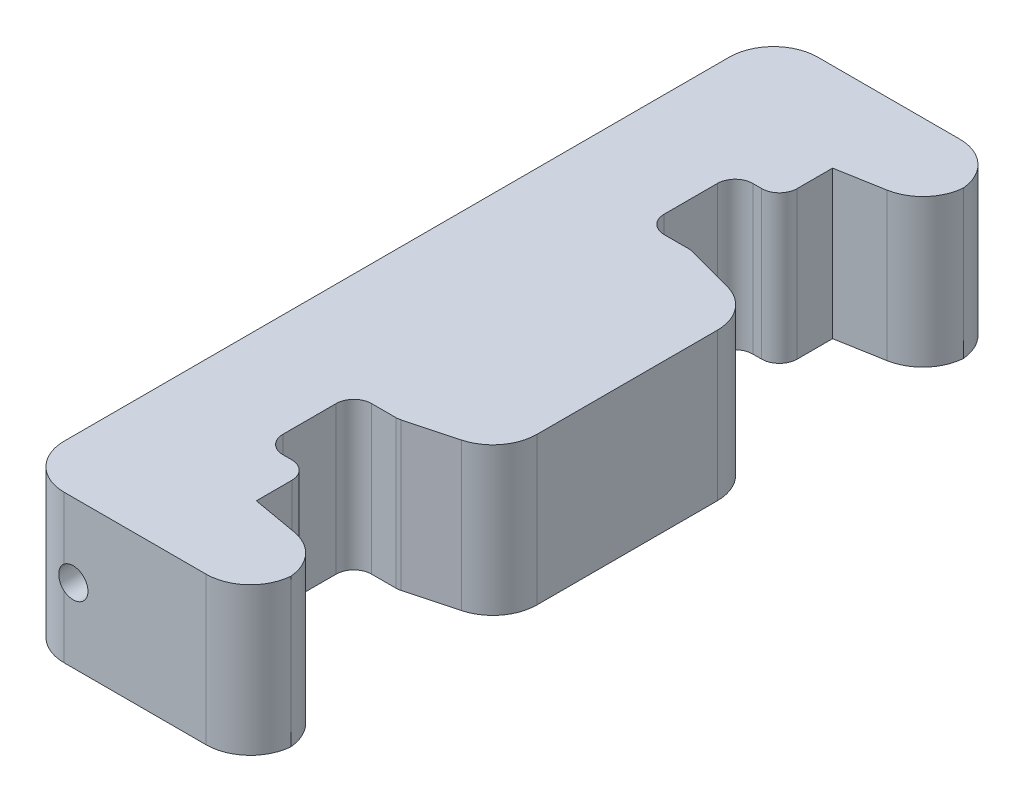
from build123d import *

# Parameters (mm, degrees)
BOSS_EXTRUDE1_DEPTH = 12.7
CUT_EXTRUDE1_DEPTH  = 38.486519244
FILLET4_R           = 1.524
FILLET5_R           = 3.81
SKETCH3_R           = 1.27
CUT_EXTRUDE2_DEPTH  = 68.465574925


with BuildPart() as part:
    # Sketch1 → Boss-Extrude1 (new body)
    with BuildSketch(Plane(origin=(0, 0, 0), x_dir=(1, 0, 0), z_dir=(0, 1, 0))):
        Polygon((5.842, 32.385), (-13.97, 32.385), (-13.97, -32.385), (5.842, -32.385), (5.842, -24.765), (-1.27, -24.765), (-1.27, -20.193), (-5.08, -20.193), (-5.08, -12.573), (-1.27, -12.573), (5.842, -12.573), (5.842, 12.573), (-1.27, 12.573), (-5.08, 12.573), (-5.08, 20.193), (-1.27, 20.193), (-1.27, 24.765), (5.842, 24.765), align=None)
    extrude(amount=BOSS_EXTRUDE1_DEPTH)

    # Sketch2 → Cut-Extrude1 (cut, through all)
    with BuildSketch(Plane(origin=(0, 12.7, 0), x_dir=(1, 0, 0), z_dir=(0, 1, 0))):
        Polygon((-1.27, 24.765), (5.842, 26.019037487), (5.842, 24.765), align=None)
        Polygon((-1.27, -24.765), (5.842, -26.019037487), (5.842, -24.765), align=None)
        Polygon((-1.27, -12.573), (5.842, -10.667345343), (5.842, -12.573), align=None)
        Polygon((-1.27, 12.573), (5.842, 10.667345343), (5.842, 12.573), align=None)
    extrude(amount=-CUT_EXTRUDE1_DEPTH, mode=Mode.SUBTRACT)

    # Fillet4
    fillet4_edges = [part.edges().sort_by_distance(p)[0] for p in [
        (-5.08, 6.35, 20.193),
        (-1.27, 6.35, 20.193),
        (-1.27, 6.35, -20.193),
        (-5.08, 6.35, -20.193),
        (-5.08, 6.35, -12.573),
        (-5.08, 6.35, 12.573),
        (-1.27, 6.35, 12.573),
        (-1.27, 6.35, -12.573),
    ]]
    fillet(fillet4_edges, radius=FILLET4_R)

    # Fillet5
    # the kernel refuses this fillet: 3.81 mm, written as the material it takes off along each edge
    with BuildSketch(Plane(origin=(5.842, -9.525, 32.385), x_dir=(-1, 0, 0), z_dir=(0, 1, 0)), Plane(origin=(-13.97, -9.525, 32.385), x_dir=(0, 0, -1), z_dir=(0, 1, 0)), Plane(origin=(-13.97, -9.525, -32.385), x_dir=(1, 0, 0), z_dir=(0, 1, 0)), Plane(origin=(5.842, -9.525, -32.385), x_dir=(0, 0, 1), z_dir=(0, 1, 0))) as fillet5_piece_1:
        with BuildLine():
            CenterArc((FILLET5_R, -FILLET5_R), FILLET5_R, 90, 90)
            Line((0, -FILLET5_R), (0, 0))
            Line((0, 0), (FILLET5_R, 0))
        make_face()
    extrude(amount=31.75, mode=Mode.SUBTRACT)
    with BuildSketch(Plane(origin=(5.842, 20.692423987, -26.019037487), x_dir=(-0.9848077530122095, 0, 0.17364817766692292), z_dir=(0, -1, 0)), Plane(origin=(5.842, 20.692423987, 26.019037487), x_dir=(0, 0, 1), z_dir=(0, -1, 0))) as fillet5_piece_2:
        with BuildLine():
            CenterArc((FILLET5_R * 0.839099631177, FILLET5_R), FILLET5_R, 190, 80)
            Line((-FILLET5_R * 0.145708121835, FILLET5_R * 0.826351822333), (0, 0))
            Line((0, 0), (FILLET5_R * 0.839099631177, 0))
        make_face()
    extrude(amount=28.684847974, mode=Mode.SUBTRACT)
    with BuildSketch(Plane(origin=(5.842, 20.00878956, 10.667345343), x_dir=(0, 0, -1), z_dir=(0, -1, 0)), Plane(origin=(5.842, 20.00878956, -10.667345343), x_dir=(-0.9659258262890701, 0, -0.258819045102514), z_dir=(0, -1, 0))) as fillet5_piece_3:
        with BuildLine():
            CenterArc((FILLET5_R * 0.767326987979, -FILLET5_R), FILLET5_R, 90, 75)
            Line((-FILLET5_R * 0.19859883831, -FILLET5_R * 0.741180954897), (0, 0))
            Line((0, 0), (FILLET5_R * 0.767326987979, 0))
        make_face()
    extrude(amount=27.317579121, mode=Mode.SUBTRACT)

    # Sketch3 → Cut-Extrude2 (cut, through all)
    with BuildSketch(Plane.XY.offset(32.385)):
        with Locations(Location((-9.391956596, 6.35, 0), (0, 0, 127.211471896))):
            Circle(SKETCH3_R)
    extrude(amount=-CUT_EXTRUDE2_DEPTH, mode=Mode.SUBTRACT)


solid = part.part
